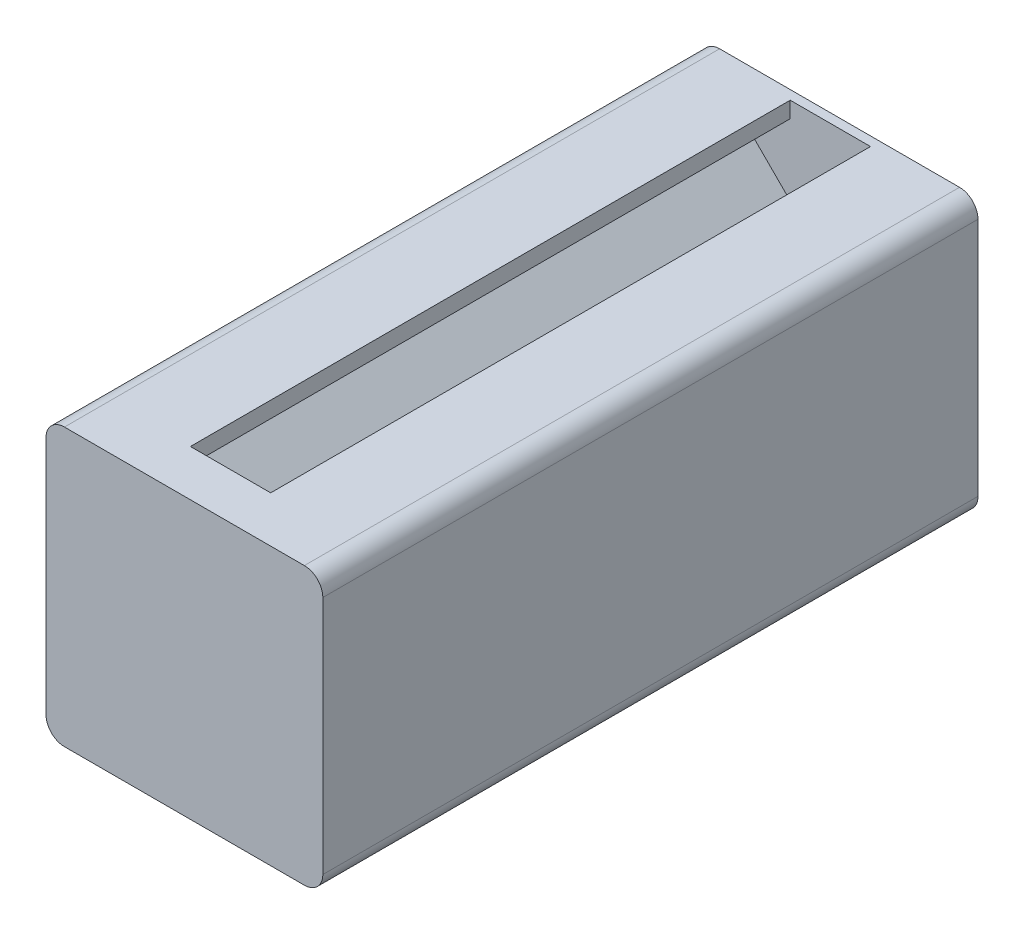
from build123d import *

# Parameters (mm, degrees)
SKETCH1_R                    = 3
SKETCH1_R_2                  = 1.65
BOSS_EXTRUDE1_DEPTH          = 65
FILLET1_R                    = 2
ESTRUSIONE_ESTRUSIONE1_START = 5
ESTRUSIONE_ESTRUSIONE1_DEPTH = 5
ESTRUSIONE_ESTRUSIONE2_DEPTH = 1
SCHIZZO3_W                   = 65
SCHIZZO3_H                   = 8.7
ESTRUSIONE_ESTRUSIONE3_DEPTH = 1


with BuildPart() as part:
    # Sketch1 → Boss-Extrude1 (new body)
    with BuildSketch(Plane.XY):
        Polygon((-8.46, 9.66), (-4.55, 5.75), (4.55, 5.75), (8.46, 9.66), (8.46, 13.26), (4.35, 13.26), (4.35, 15), (15, 15), (15, 4.35), (13.26, 4.35), (13.26, 8.46), (9.66, 8.46), (5.75, 4.55), (5.75, -4.55), (9.66, -8.46), (13.26, -8.46), (13.26, -4.35), (15, -4.35), (15, -15), (4.35, -15), (4.35, -13.26), (8.46, -13.26), (8.46, -9.59186747), (4.61813253, -5.75), (-4.578313253, -5.75), (-8.420180723, -9.59186747), (-8.420180723, -13.26), (-4.35, -13.26), (-4.35, -15), (-15, -15), (-15, -4.35), (-13.26, -4.35), (-13.26, -8.46), (-9.66, -8.46), (-5.75, -4.55), (-5.75, 4.55), (-9.66, 8.46), (-13.26, 8.46), (-13.26, 4.35), (-15, 4.35), (-15, 15), (-4.35, 15), (-4.35, 13.26), (-8.46, 13.26), align=None)
        Circle(SKETCH1_R, mode=Mode.SUBTRACT)
        with Locations((11.73, 11.73)):
            Circle(SKETCH1_R_2, mode=Mode.SUBTRACT)
        with Locations((11.73, -11.73)):
            Circle(SKETCH1_R_2, mode=Mode.SUBTRACT)
        with Locations((-11.73, -11.73)):
            Circle(SKETCH1_R_2, mode=Mode.SUBTRACT)
        with Locations((-11.73, 11.73)):
            Circle(SKETCH1_R_2, mode=Mode.SUBTRACT)
    extrude(amount=BOSS_EXTRUDE1_DEPTH)

    # Fillet1
    fillet1_edges = [part.edges().sort_by_distance(p)[0] for p in [
        (-15, -15, 32.5),
        (15, -15, 32.5),
        (15, 15, 32.5),
        (-15, 15, 32.5),
    ]]
    fillet(fillet1_edges, radius=FILLET1_R)

    # Schizzo1 → Estrusione-Estrusione1 (add)
    with BuildSketch(Plane.XY.offset(65).offset(ESTRUSIONE_ESTRUSIONE1_START)):
        with BuildLine():
            Line((13, 15), (4.35, 15))
            Line((4.35, 15), (-4.35, 15))
            Line((-4.35, 15), (-13, 15))
            ThreePointArc((-13, 15), (-14.414213562, 14.414213562), (-15, 13))
            Line((-15, 13), (-15, 4.35))
            Line((-15, 4.35), (-15, -4.35))
            Line((-15, -4.35), (-15, -13))
            ThreePointArc((-15, -13), (-14.414213562, -14.414213562), (-13, -15))
            Line((-13, -15), (-4.35, -15))
            Line((-4.35, -15), (4.35, -15))
            Line((4.35, -15), (13, -15))
            ThreePointArc((13, -15), (14.414213562, -14.414213562), (15, -13))
            Line((15, -13), (15, -4.35))
            Line((15, -4.35), (15, 4.35))
            Line((15, 4.35), (15, 13))
            ThreePointArc((15, 13), (14.414213562, 14.414213562), (13, 15))
        make_face()
    extrude(amount=-ESTRUSIONE_ESTRUSIONE1_DEPTH)

    # Schizzo2 → Estrusione-Estrusione2 (add)
    with BuildSketch(Plane(origin=(0, 0, 0), x_dir=(-1, 0, 0), z_dir=(0, 0, -1))):
        with BuildLine():
            Line((-13, 15), (13, 15))
            ThreePointArc((13, 15), (14.414213562, 14.414213562), (15, 13))
            Line((15, 13), (15, -13))
            ThreePointArc((15, -13), (14.414213562, -14.414213562), (13, -15))
            Line((13, -15), (-13, -15))
            ThreePointArc((-13, -15), (-14.414213562, -14.414213562), (-15, -13))
            Line((-15, -13), (-15, 13))
            ThreePointArc((-15, 13), (-14.414213562, 14.414213562), (-13, 15))
        make_face()
    extrude(amount=ESTRUSIONE_ESTRUSIONE2_DEPTH)

    # Schizzo3 → Estrusione-Estrusione3 (add)
    with BuildSketch(Plane(origin=(15, 0, 0), x_dir=(0, 0, -1), z_dir=(1, 0, 0))):
        with Locations((-32.5, 0)):
            Rectangle(SCHIZZO3_W, SCHIZZO3_H)
    extrude(amount=-ESTRUSIONE_ESTRUSIONE3_DEPTH)


solid = part.part
